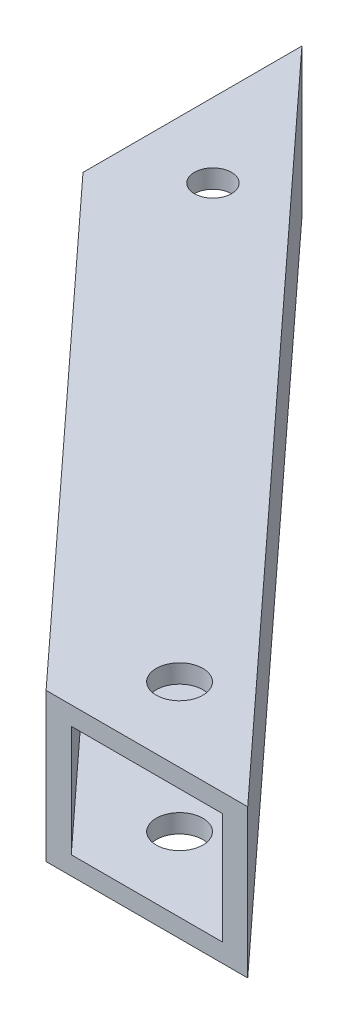
from build123d import *

# Parameters (mm, degrees)
BOSS_EXTRUDE3_DEPTH = 25.4
CUT_EXTRUDE4_REACH  = 185.634
SKETCH2_W           = 19.05
SKETCH2_H           = 19.05
CUT_EXTRUDE5_DEPTH  = 25.4
SKETCH4_R           = 3.988266949
CUT_EXTRUDE6_DEPTH  = 3.175
SKETCH5_R           = 3.175
CUT_EXTRUDE7_DEPTH  = 3.175


with BuildPart() as part:
    # Sketch1 → Boss-Extrude3 (new body)
    with BuildSketch(Plane(origin=(0, 0, 0), x_dir=(1, 0, 0), z_dir=(0, 1, 0))):
        Polygon((73.659861316, 0), (108.190600856, 0), (0, 117.475), (-18.683642708, 100.267981224), align=None)
    extrude(amount=BOSS_EXTRUDE3_DEPTH)

    # Cut-Extrude4: up to this plane
    cut_extrude4_end = Plane(origin=(0, 25.4, 0), z_dir=(0, 0, -1))
    # Sketch2 → Cut-Extrude4 (cut, up to the surface)
    with BuildSketch(Plane(origin=(-58.537665842, 0, -63.563740241), x_dir=(0.735576484560878, 0, -0.6774416841035549), z_dir=(0.6774416841035549, 0, 0.735576484560878)), mode=Mode.PRIVATE) as cut_extrude4_sk1:
        with Locations((66.880665058, 12.7)):
            Rectangle(SKETCH2_W, SKETCH2_H)
    cut_extrude4_tool1 = split(extrude(cut_extrude4_sk1.sketch, amount=CUT_EXTRUDE4_REACH, mode=Mode.PRIVATE), bisect_by=cut_extrude4_end, keep=Keep.BOTH, mode=Mode.PRIVATE)
    add(cut_extrude4_tool1.solids().sort_by_distance((-9.341821, 12.7, -108.871491))[0], mode=Mode.SUBTRACT)

    # Sketch3 → Cut-Extrude5 (cut)
    with BuildSketch(Plane(origin=(0, 25.4, 0), x_dir=(1, 0, 0), z_dir=(0, 1, 0))):
        Polygon((0, 117.475), (0, 79.980997791), (-18.683642708, 100.267981224), align=None)
        Polygon((108.190600856, 0), (73.659861316, 0), (89.250643344, -17.183967795), align=None)
    extrude(amount=-CUT_EXTRUDE5_DEPTH, mode=Mode.SUBTRACT)

    # Sketch4 → Cut-Extrude6 (cut)
    with BuildSketch(Plane(origin=(0, 25.4, 0), x_dir=(1, 0, 0), z_dir=(0, 1, 0))):
        with Locations((83.819861316, 12.7)):
            Circle(SKETCH4_R)
    cut_extrude6 = extrude(amount=-CUT_EXTRUDE6_DEPTH, mode=Mode.SUBTRACT)

    # Mirror1: Cut-Extrude6 across plane
    add(cut_extrude6.mirror(Plane.ZX.offset(12.7)), mode=Mode.SUBTRACT)

    # Sketch5 → Cut-Extrude7 (cut)
    with BuildSketch(Plane.XZ):
        with Locations((12.7, -89.535)):
            Circle(SKETCH5_R)
    cut_extrude7 = extrude(amount=-CUT_EXTRUDE7_DEPTH, mode=Mode.SUBTRACT)

    # Mirror2: Cut-Extrude7 across plane
    add(cut_extrude7.mirror(Plane.ZX.offset(12.7)), mode=Mode.SUBTRACT)


solid = part.part
